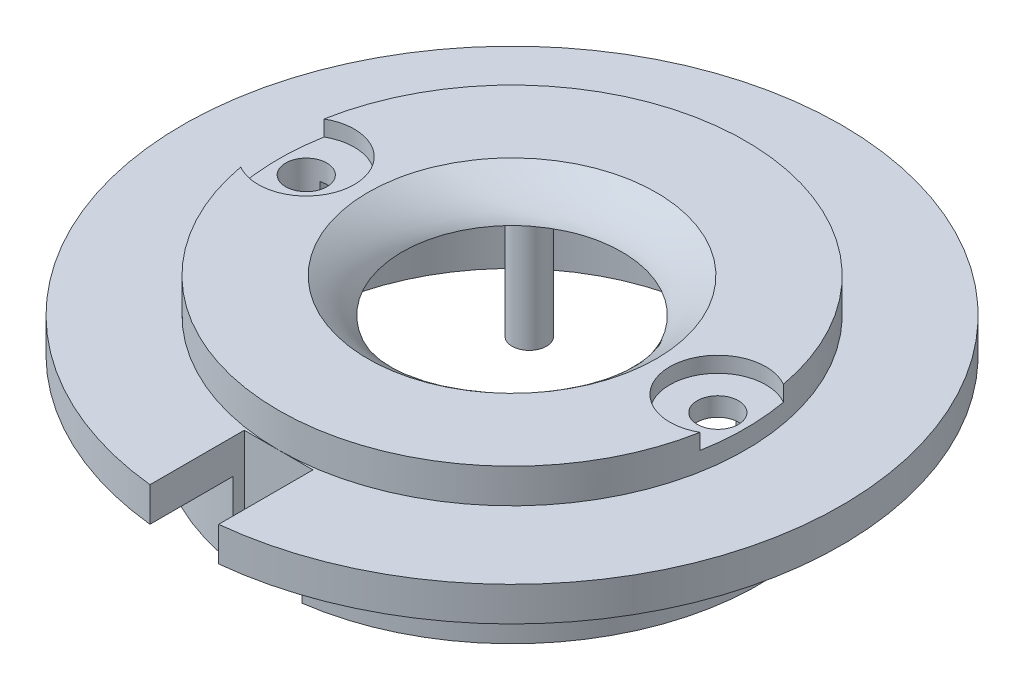
from build123d import *

# Parameters (mm, degrees)
SKETCH5_R               = 22.843403387
SKETCH5_R_2             = 13.335
BOSS_EXTRUDE2_DEPTH     = 3.175
SKETCH8_R               = 22.843403387
SKETCH8_R_2             = 19.668403387
BOSS_EXTRUDE3_DEPTH     = 10.16
CUT_EXTRUDE2_DEPTH      = 35.949454799
CUT_EXTRUDE2_DEPTH_BACK = 35.949454799
SKETCH9_R               = 1.905
SKETCH11_R              = 22.843403387
SKETCH11_R_2            = 21.59
CUT_EXTRUDE3_DEPTH      = 3.175
SKETCH12_R              = 30.48
SKETCH12_R_2            = 21.59
BOSS_EXTRUDE4_DEPTH     = 3.175
CUT_EXTRUDE4_DEPTH      = 45.286413266
CUT_EXTRUDE4_DEPTH_BACK = 45.286413266
SKETCH13_W              = 6.35
SKETCH13_H              = 8.89
SKETCH14_R              = 4.445
CUT_EXTRUDE5_DEPTH      = 1.4478
SKETCH15_R              = 1.5875
BOSS_EXTRUDE5_DEPTH     = 13.21
SKETCH16_R              = 1.27
CUT_EXTRUDE6_DEPTH      = 3.175


with BuildPart() as part:
    # Loft1: read off the stored shape, not the designer's step
    # Loft1: loft between two sections, ruled curve by curve
    loft1_from = [
        Edge.make_bspline([(10.081206282, 0, 5.386481216), (20.854168715, 0, -14.775931349), (0.69175615, 0, -25.548893781), (-10.081206282, 0, -5.386481216), (-20.854168715, 0, 14.775931349), (-0.69175615, 0, 25.548893781), (10.081206282, 0, 5.386481216)], [0, 0, 0, 0, 0.5, 0.5, 0.5, 1, 1, 1, 1], 3, [1, 0.333333333, 0.333333333, 1, 0.333333333, 0.333333333, 1]),
    ]
    loft1_to = [
        Edge.make_bspline([(16.298540151, 3.175, 2.633949306), (21.566438762, 3.175, -29.963130997), (-11.03064154, 3.175, -35.231029608), (-16.298540151, 3.175, -2.633949306), (-21.566438762, 3.175, 29.963130997), (11.03064154, 3.175, 35.231029608), (16.298540151, 3.175, 2.633949306)], [0, 0, 0, 0, 0.5, 0.5, 0.5, 1, 1, 1, 1], 3, [1, 0.333333333, 0.333333333, 1, 0.333333333, 0.333333333, 1]),
    ]
    loft1 = Solid(Shell([*[Face.make_surface_from_curves(loft1_from[k], loft1_to[k]) for k in range(1)], Face(Wire(loft1_from)), Face(Wire(loft1_to))]))
    add(loft1)

    # Cut-Loft1: read off the stored shape, not the designer's step
    # Cut-Loft1: loft between two sections, ruled curve by curve
    cut_loft1_from = [
        Edge.make_bspline([(11.717693295, 3.175, 6.365366356), (-1.013039416, 3.175, 29.800752946), (-24.448426006, 3.175, 17.070020235), (-11.717693295, 3.175, -6.365366356), (1.013039416, 3.175, -29.800752946), (24.448426006, 3.175, -17.070020235), (11.717693295, 3.175, 6.365366356)], [0, 0, 0, 0, 0.5, 0.5, 0.5, 1, 1, 1, 1], 3, [1, 0.333333333, 0.333333333, 1, 0.333333333, 0.333333333, 1]),
    ]
    cut_loft1_to = [
        Edge.make_bspline([(5.259513685, 0, 8.692704746), (-12.125895806, 0, 19.211732116), (-22.644923177, 0, 1.826322624), (-5.259513685, 0, -8.692704746), (12.125895806, 0, -19.211732116), (22.644923177, 0, -1.826322624), (5.259513685, 0, 8.692704746)], [0, 0, 0, 0, 0.5, 0.5, 0.5, 1, 1, 1, 1], 3, [1, 0.333333333, 0.333333333, 1, 0.333333333, 0.333333333, 1]),
    ]
    cut_loft1 = Solid(Shell([*[Face.make_surface_from_curves(cut_loft1_from[k], cut_loft1_to[k]) for k in range(1)], Face(Wire(cut_loft1_from)), Face(Wire(cut_loft1_to))]))
    add(cut_loft1, mode=Mode.SUBTRACT)

    # Sketch5 → Boss-Extrude2 (add)
    with BuildSketch(Plane(origin=(0, 3.175, 0), x_dir=(1, 0, 0), z_dir=(0, 1, 0))):
        with Locations(Location((0, 0, 0), (0, 0, 270))):
            Circle(SKETCH5_R)
        with Locations(Location((0, 0, 0), (0, 0, 270))):
            Circle(SKETCH5_R_2, mode=Mode.SUBTRACT)
    extrude(amount=-BOSS_EXTRUDE2_DEPTH)

    # Sketch10 → Revolve4 (revolve)
    with BuildSketch(Plane.XY):
        Polygon((-13.335, 1.305724577), (-10.16, 0), (-13.335, 0), align=None)
    revolve(axis=Axis((0, -10.16, 0), (0, 1, 0)))

    # Sketch8 → Boss-Extrude3 (add)
    with BuildSketch(Plane(origin=(0, 0, 0), x_dir=(-1, 0, 0), z_dir=(0, -1, 0))):
        with Locations(Location((0, 0, 0), (0, 0, 270))):
            Circle(SKETCH8_R)
        with Locations(Location((0, 0, 0), (0, 0, 90))):
            Circle(SKETCH8_R_2, mode=Mode.SUBTRACT)
    extrude(amount=BOSS_EXTRUDE3_DEPTH)

    # Sketch9 → Cut-Extrude2 (cut, two sides: drawn at the far end of the back side and taken through both)
    with BuildSketch(Plane(origin=(0, 3.175, 0), x_dir=(1, 0, 0), z_dir=(0, 1, 0)).offset(-CUT_EXTRUDE2_DEPTH_BACK)):
        with Locations(Location((19.033403387, 0, 0), (0, 0, 270))):
            Circle(SKETCH9_R)
        with Locations(Location((-19.033403387, 0, 0), (0, 0, 270))):
            Circle(SKETCH9_R)
    extrude(amount=CUT_EXTRUDE2_DEPTH + CUT_EXTRUDE2_DEPTH_BACK, mode=Mode.SUBTRACT)

    # Sketch11 → Cut-Extrude3 (cut)
    with BuildSketch(Plane(origin=(0, 3.175, 0), x_dir=(1, 0, 0), z_dir=(0, 1, 0))):
        with Locations(Location((0, 0, 0), (0, 0, 270))):
            Circle(SKETCH11_R)
        with Locations(Location((0, 0, 0), (0, 0, 270))):
            Circle(SKETCH11_R_2, mode=Mode.SUBTRACT)
    extrude(amount=-CUT_EXTRUDE3_DEPTH, mode=Mode.SUBTRACT)

    # Sketch12 → Boss-Extrude4 (add)
    with BuildSketch(Plane(origin=(0, 0, 0), x_dir=(1, 0, 0), z_dir=(0, 1, 0))):
        with Locations(Location((0, 0, 0), (0, 0, 270))):
            Circle(SKETCH12_R)
        with Locations(Location((0, 0, 0), (0, 0, 270))):
            Circle(SKETCH12_R_2, mode=Mode.SUBTRACT)
    extrude(amount=-BOSS_EXTRUDE4_DEPTH)

    # Sketch13 → Cut-Extrude4 (cut, two sides: drawn at the far end of the back side and taken through both)
    with BuildSketch(Plane(origin=(0, 0, 0), x_dir=(1, 0, 0), z_dir=(0, 1, 0)).offset(-CUT_EXTRUDE4_DEPTH_BACK)):
        with Locations((0, -26.035)):
            Rectangle(SKETCH13_W, SKETCH13_H)
    extrude(amount=CUT_EXTRUDE4_DEPTH + CUT_EXTRUDE4_DEPTH_BACK, mode=Mode.SUBTRACT)

    # Sketch14 → Cut-Extrude5 (cut)
    with BuildSketch(Plane(origin=(0, 3.175, 0), x_dir=(1, 0, 0), z_dir=(0, 1, 0))):
        with Locations((-19.033403387, 0)):
            Circle(SKETCH14_R)
        with Locations((19.033403387, 0)):
            Circle(SKETCH14_R)
    extrude(amount=-CUT_EXTRUDE5_DEPTH, mode=Mode.SUBTRACT)

    # Sketch15 → Boss-Extrude5 (add)
    with BuildSketch(Plane.XZ):
        with Locations(Location((10.276942125, -12.684023832, 0), (0, 0, 90))):
            Circle(SKETCH15_R)
        with Locations(Location((-10.719763295, -12.312054049, 0), (0, 0, 90))):
            Circle(SKETCH15_R)
    extrude(amount=BOSS_EXTRUDE5_DEPTH)

    # Sketch16 → Cut-Extrude6 (cut)
    with BuildSketch(Plane(origin=(0, -13.21, 0), x_dir=(-1, 0, 0), z_dir=(0, -1, 0))):
        with Locations(Location((10.719763295, 12.312054049, 0), (0, 0, 90))):
            Circle(SKETCH16_R)
        with Locations(Location((-10.276942125, 12.684023832, 0), (0, 0, 90))):
            Circle(SKETCH16_R)
    extrude(amount=-CUT_EXTRUDE6_DEPTH, mode=Mode.SUBTRACT)


solid = part.part
